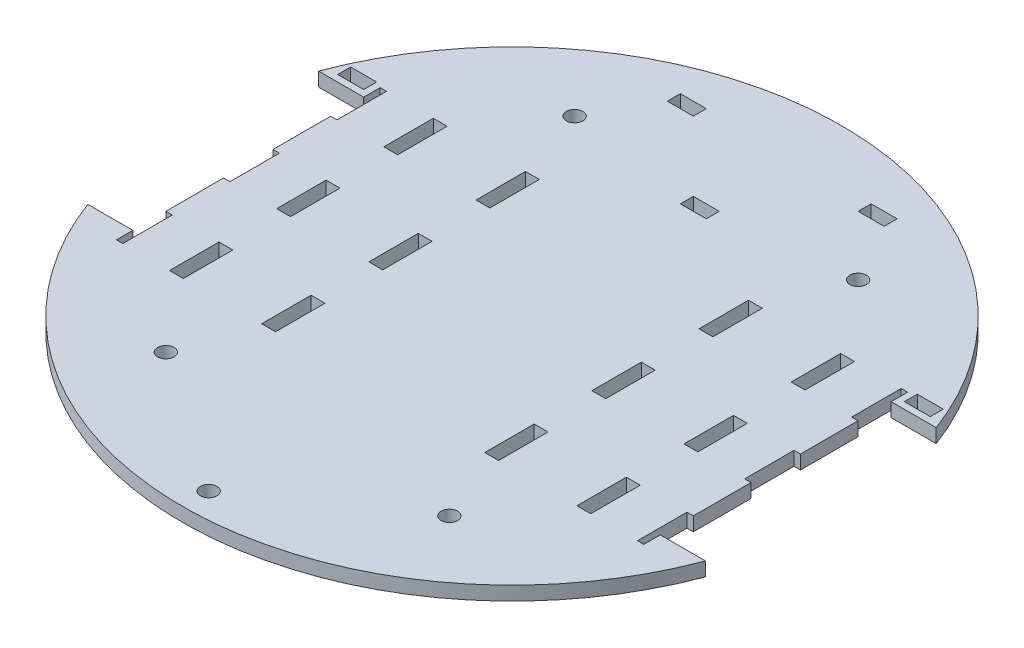
from build123d import *

# Parameters (mm, degrees)
BASE_DEPTH                = 5.334
SKETCH9_W                 = 10
SKETCH9_H                 = 5
TAPE_SENSOR_CUTOUTS_DEPTH = 175.099537782
SKETCH6_W                 = 5.334
SKETCH6_H                 = 19.05
SKETCH6_W_2               = 2.4638
RIGHT_MOUNT_SLOTS_DEPTH   = 175.099537782
SKETCH7_W                 = 5.334
SKETCH7_H                 = 19.05
SKETCH7_W_2               = 2.4638
LEFT_MOUNT_SLOTS_DEPTH    = 175.099537782
SKETCH8_R                 = 3.175
CASTER_SCREWS_DEPTH       = 175.099537782
HOLE1_OUTLINE_R           = 3.175
HOLE1_DEPTH               = 5.334


# Read off the part's stored shape, not the designer's step: Hole1
with BuildPart() as part:
    # Sketch1 → Base (new body)
    with BuildSketch(Plane(origin=(0, 0, 0), x_dir=(1, 0, 0), z_dir=(0, 1, 0))):
        with BuildLine():
            Line((118.967211869, -44.45), (101.6, -44.45))
            Line((101.6, -44.45), (101.6, 44.45))
            Line((101.6, 44.45), (118.967211869, 44.45))
            ThreePointArc((118.967211869, 44.45), (0, 127), (-118.967211869, 44.45))
            Line((-118.967211869, 44.45), (-101.6, 44.45))
            Line((-101.6, 44.45), (-101.6, -44.45))
            Line((-101.6, -44.45), (-118.967211869, -44.45))
            ThreePointArc((-118.967211869, -44.45), (0, -127), (118.967211869, -44.45))
        make_face()
    extrude(amount=BASE_DEPTH)

    # Sketch9 → Tape Sensor Cutouts (cut, through all)
    with BuildSketch(Plane(origin=(0, 5.334, 0), x_dir=(1, 0, 0), z_dir=(0, 1, 0))):
        with Locations((-36.75, 104.1)):
            Rectangle(SKETCH9_W, SKETCH9_H)
        with Locations((36.75, 104.1)):
            Rectangle(SKETCH9_W, SKETCH9_H)
        with Locations((0, 72.35)):
            Rectangle(SKETCH9_W, SKETCH9_H)
        with Locations((-109.14, 49.49)):
            Rectangle(SKETCH9_W, SKETCH9_H)
        with Locations((109.14, 49.49)):
            Rectangle(SKETCH9_W, SKETCH9_H)
    extrude(amount=-TAPE_SENSOR_CUTOUTS_DEPTH, mode=Mode.SUBTRACT)

    # Sketch6 → Right Mount Slots (cut, through all)
    with BuildSketch(Plane.XZ):
        with Locations((42.967, 41.275)):
            Rectangle(SKETCH6_W, SKETCH6_H)
        with Locations((42.967, 0)):
            Rectangle(SKETCH6_W, SKETCH6_H)
        with Locations((42.967, -41.275)):
            Rectangle(SKETCH6_W, SKETCH6_H)
        with Locations((100.3681, 41.275)):
            Rectangle(SKETCH6_W_2, SKETCH6_H)
        with Locations((100.3681, 0)):
            Rectangle(SKETCH6_W_2, SKETCH6_H)
        with Locations((100.3681, -41.275)):
            Rectangle(SKETCH6_W_2, SKETCH6_H)
        with Locations((78.4692, 41.275)):
            Rectangle(SKETCH6_W, SKETCH6_H)
        with Locations((78.4692, 0)):
            Rectangle(SKETCH6_W, SKETCH6_H)
        with Locations((78.4692, -41.275)):
            Rectangle(SKETCH6_W, SKETCH6_H)
    extrude(amount=-RIGHT_MOUNT_SLOTS_DEPTH, mode=Mode.SUBTRACT)

    # Sketch7 → Left Mount Slots (cut, through all)
    with BuildSketch(Plane.XZ):
        with Locations((-78.4692, 0)):
            Rectangle(SKETCH7_W, SKETCH7_H)
        with Locations((-78.4692, 41.275)):
            Rectangle(SKETCH7_W, SKETCH7_H)
        with Locations((-78.4692, -41.275)):
            Rectangle(SKETCH7_W, SKETCH7_H)
        with Locations((-42.967, 41.275)):
            Rectangle(SKETCH7_W, SKETCH7_H)
        with Locations((-42.967, 0)):
            Rectangle(SKETCH7_W, SKETCH7_H)
        with Locations((-42.967, -41.275)):
            Rectangle(SKETCH7_W, SKETCH7_H)
        with Locations((-100.3681, 41.275)):
            Rectangle(SKETCH7_W_2, SKETCH7_H)
        with Locations((-100.3681, 0)):
            Rectangle(SKETCH7_W_2, SKETCH7_H)
        with Locations((-100.3681, -41.275)):
            Rectangle(SKETCH7_W_2, SKETCH7_H)
    extrude(amount=-LEFT_MOUNT_SLOTS_DEPTH, mode=Mode.SUBTRACT)

    # Sketch8 → Caster Screws (cut, through all)
    with BuildSketch(Plane(origin=(0, 5.334, 0), x_dir=(1, 0, 0), z_dir=(0, 1, 0))):
        with Locations(Location((0, -116.84, 0), (0, 0, 270))):
            Circle(SKETCH8_R)
    extrude(amount=-CASTER_SCREWS_DEPTH, mode=Mode.SUBTRACT)

    # Hole1 outline → Hole1 (cut)
    with BuildSketch(Plane(origin=(0, 0, 0), x_dir=(1, 0, 0), z_dir=(0, 1, 0))):
        with Locations((-54.61, -78.74)):
            Circle(HOLE1_OUTLINE_R)
        with Locations((54.61, -78.74)):
            Circle(HOLE1_OUTLINE_R)
        with Locations((54.61, 78.74)):
            Circle(HOLE1_OUTLINE_R)
        with Locations((-54.61, 78.74)):
            Circle(HOLE1_OUTLINE_R)
    extrude(amount=HOLE1_DEPTH, mode=Mode.SUBTRACT)


solid = part.part
